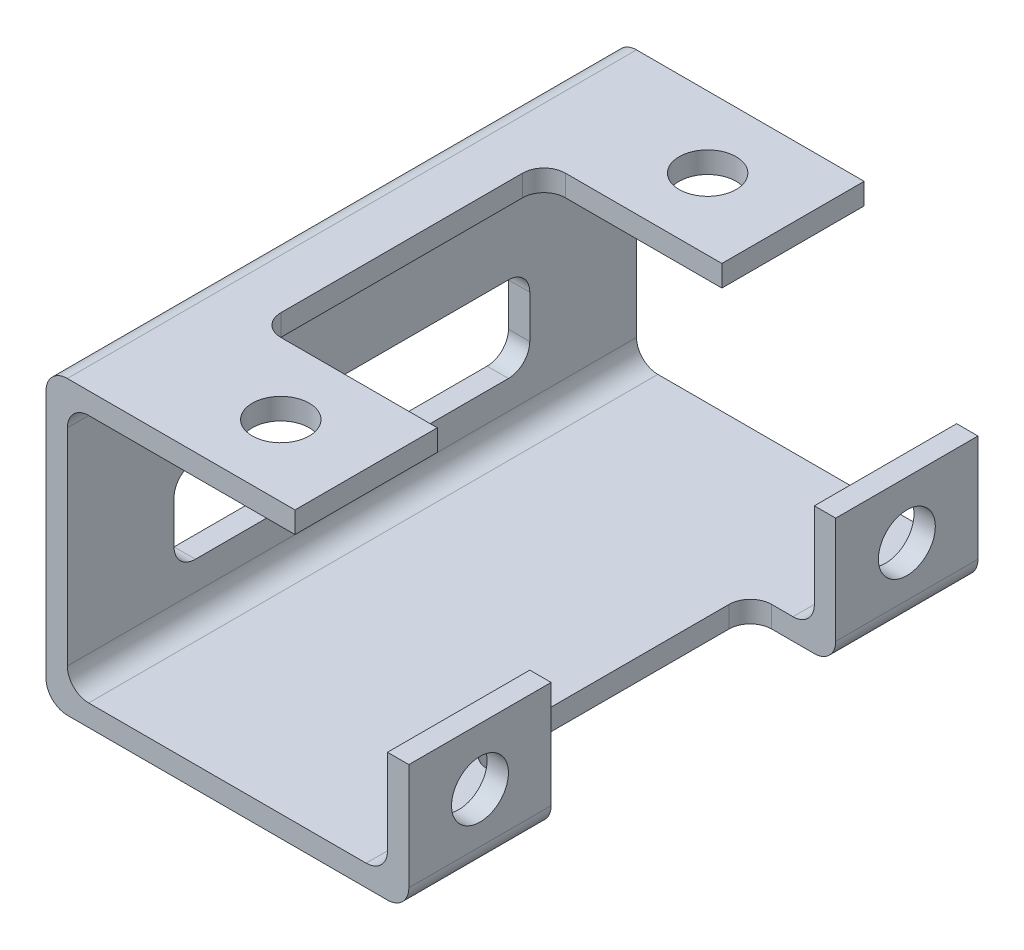
from build123d import *

# Parameters (mm, degrees)
SKETCH2_W           = 45
SKETCH2_H           = 80
BOSS_EXTRUDE2_DEPTH = 35
SHELL2_T            = 3
SKETCH5_R           = 4
CUT_EXTRUDE1_DEPTH  = 3
SKETCH6_R           = 4
CUT_EXTRUDE2_DEPTH  = 3
SKETCH7_W           = 12
SKETCH7_H           = 40
CUT_EXTRUDE3_DEPTH  = 3
SKETCH8_W           = 50
SKETCH8_H           = 12
CUT_EXTRUDE4_DEPTH  = 3
FILLET1_R           = 3
FILLET2_R           = 3


with BuildPart() as part:
    # Sketch2 → Boss-Extrude2 (new body)
    with BuildSketch(Plane(origin=(0, 0, 0), x_dir=(1, 0, 0), z_dir=(0, 1, 0))):
        with Locations((22.5, -40)):
            Rectangle(SKETCH2_W, SKETCH2_H)
    extrude(amount=BOSS_EXTRUDE2_DEPTH)

    # Shell2
    shell2_openings = [part.faces().sort_by_distance(p)[0] for p in [
        (22.5, 17.5, 0),
        (22.5, 17.5, 80),
    ]]
    offset(amount=SHELL2_T, openings=shell2_openings, kind=Kind.INTERSECTION)

    # Sketch5 → Cut-Extrude1 (cut)
    with BuildSketch(Plane(origin=(0, 38, 0), x_dir=(1, 0, 0), z_dir=(0, 1, 0))):
        with Locations(Location((20, -70, 0), (0, 0, 270))):
            Circle(SKETCH5_R)
        with Locations(Location((20, -10, 0), (0, 0, 270))):
            Circle(SKETCH5_R)
        Polygon((32, 0), (32, -20), (7, -20), (7, -60), (32, -60), (32, -80), (48, -80), (48, 0), align=None)
    extrude(amount=-CUT_EXTRUDE1_DEPTH, mode=Mode.SUBTRACT)

    # Sketch6 → Cut-Extrude2 (cut)
    with BuildSketch(Plane(origin=(48, 0, 0), x_dir=(0, 0, -1), z_dir=(1, 0, 0))):
        with Locations((-70, 7)):
            Circle(SKETCH6_R)
        with Locations((-10, 7)):
            Circle(SKETCH6_R)
        Polygon((-80, 15), (-60, 15), (-60, -3), (-20, -3), (-20, 15), (0, 15), (0, 35), (-80, 35), align=None)
    extrude(amount=-CUT_EXTRUDE2_DEPTH, mode=Mode.SUBTRACT)

    # Sketch7 → Cut-Extrude3 (cut)
    with BuildSketch(Plane.XZ.offset(3)):
        with Locations((42, 40)):
            Rectangle(SKETCH7_W, SKETCH7_H)
    extrude(amount=-CUT_EXTRUDE3_DEPTH, mode=Mode.SUBTRACT)

    # Sketch8 → Cut-Extrude4 (cut)
    with BuildSketch(Plane.ZY.offset(3)):
        with Locations((40, 13)):
            Rectangle(SKETCH8_W, SKETCH8_H)
    extrude(amount=-CUT_EXTRUDE4_DEPTH, mode=Mode.SUBTRACT)

    # Fillet1
    fillet1_edges = [part.edges().sort_by_distance(p)[0] for p in [
        (36, -1.5, 60),
        (36, -1.5, 20),
        (0, 0, 40),
        (45, 0, 70),
        (0, 35, 40),
        (7, 36.5, 60),
        (7, 36.5, 20),
        (-3, 38, 40),
        (48, -3, 70),
        (-3, -3, 40),
        (45, 0, 10),
        (48, -3, 10),
    ]]
    fillet(fillet1_edges, radius=FILLET1_R - 0.0001)  # a hair under: the kernel refuses the full size

    # Fillet2
    fillet2_edges = [part.edges().sort_by_distance(p)[0] for p in [
        (-1.5, 7, 65),
        (-1.5, 19, 65),
        (-1.5, 19, 15),
        (-1.5, 7, 15),
    ]]
    fillet(fillet2_edges, radius=FILLET2_R)


solid = part.part
